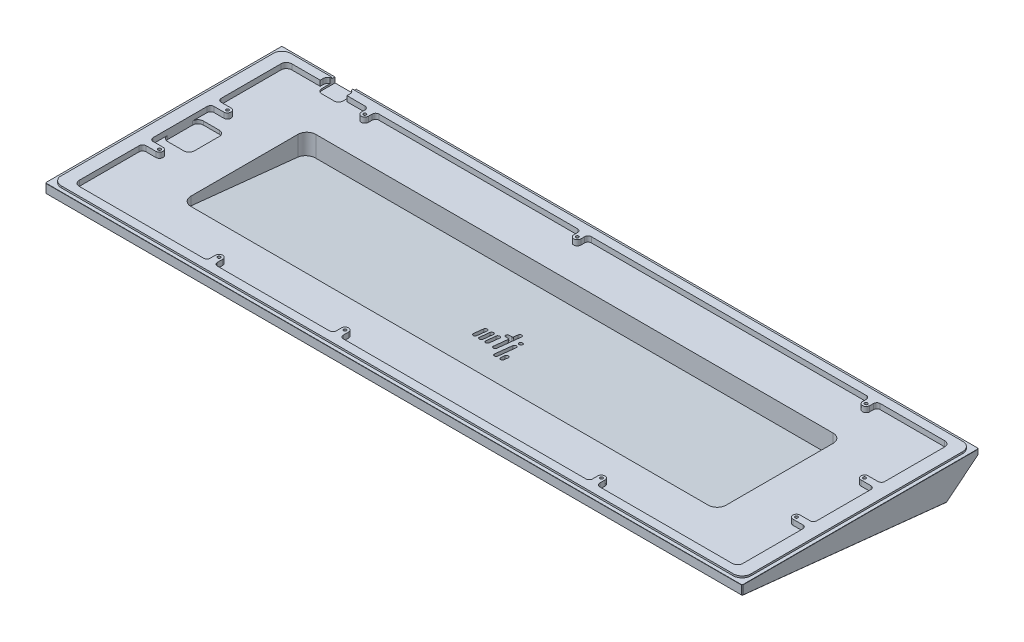
from build123d import *
from OCP.BRepFilletAPI import BRepFilletAPI_MakeChamfer

# Parameters (mm, degrees)
SKETCH1_W                 = 390.7
SKETCH1_H                 = 132.7
MAINBODY_DEPTH            = 18.5
SKETCH2_W                 = 390.7
SKETCH2_H                 = 132.7
SKETCH2_W_2               = 386.6
SKETCH2_H_2               = 128.6
ALIGMENTLIP_DEPTH         = 1
TYPINGANGLE_DEPTH         = 414.035143783
SKETCH4_W                 = 372
SKETCH4_H                 = 119.1
PCBCUTOUT_DEPTH           = 3
SKETCH13_W                = 15
SKETCH13_H                = 20
CUT_EXTRUDE4_DEPTH        = 2
FILLET2_R                 = 3
CHAMFER1_SIZE             = 0.5
CHAMFER1_SIZE_2           = 0.561801899
CHAMFER2_SIZE             = 0.1
SKETCH17_R                = 1
SKETCH17_W                = 2
SKETCH17_H                = 2
CUT_EXTRUDE5_DEPTH        = 10
SKETCH18_W                = 12
SKETCH18_H                = 4
CUT_EXTRUDE6_DEPTH        = 10
SKETCH12_W                = 15
SKETCH12_H                = 3.95
CUT_EXTRUDE3_DEPTH        = 3
FILLET1_R                 = 2.5
SKETCH19_R                = 2
SKETCH19_W                = 4
SKETCH19_H                = 4
SKETCH19_W_2              = 7.45
SKETCH19_H_2              = 4.8
BOSS_EXTRUDE1_DEPTH       = 3
FILLET3_R                 = 1.9
M2X0_4_TAPPED_HOLE1_D     = 1.6
M2X0_4_TAPPED_HOLE1_DEPTH = 4
M2X0_4_TAPPED_HOLE1_TIP   = 0.480688495
CHAMFER3_SIZE             = 0.1
FILLET4_R                 = 5
CUT_EXTRUDE7_REACH        = 414.912
SKETCH23_W                = 300
SKETCH23_H                = 70
FILLET5_R                 = 5
FILLET6_R                 = 0.5


# Some blends are built 0.0001 mm under size
with BuildPart() as part:
    # Sketch1 → MainBody (new body)
    with BuildSketch(Plane(origin=(0, 0, 0), x_dir=(1, 0, 0), z_dir=(0, 1, 0))):
        with Locations((195.35, 66.35)):
            Rectangle(SKETCH1_W, SKETCH1_H)
    extrude(amount=MAINBODY_DEPTH)

    # Sketch2 → AligmentLip (cut)
    with BuildSketch(Plane(origin=(0, 18.5, 0), x_dir=(1, 0, 0), z_dir=(0, 1, 0))):
        with Locations((195.35, 66.35)):
            Rectangle(SKETCH2_W, SKETCH2_H)
        with Locations((195.35, 66.35)):
            Rectangle(SKETCH2_W_2, SKETCH2_H_2, mode=Mode.SUBTRACT)
    extrude(amount=-ALIGMENTLIP_DEPTH, mode=Mode.SUBTRACT)

    # Sketch3 → TypingAngle (cut, through all)
    with BuildSketch(Plane.ZY):
        Polygon((-114.79399123, 0), (-132.7, 14.5), (-132.7, 0), align=None)
        Polygon((0, 12.065334661), (-114.79399123, 0), (0, 0), align=None)
    extrude(amount=-TYPINGANGLE_DEPTH, mode=Mode.SUBTRACT)

    # Sketch4 → PCBCutout (cut)
    with BuildSketch(Plane(origin=(0, 18.5, 0), x_dir=(1, 0, 0), z_dir=(0, 1, 0))):
        with Locations((195.35, 66.35)):
            Rectangle(SKETCH4_W, SKETCH4_H)
    extrude(amount=-PCBCUTOUT_DEPTH, mode=Mode.SUBTRACT)

    # Sketch13 → Cut-Extrude4 (cut)
    with BuildSketch(Plane(origin=(0, 15.5, 0), x_dir=(1, 0, 0), z_dir=(0, 1, 0))):
        with Locations((16.85, 66.35)):
            Rectangle(SKETCH13_W, SKETCH13_H)
    extrude(amount=-CUT_EXTRUDE4_DEPTH, mode=Mode.SUBTRACT)

    # Fillet2
    fillet2_edges = [part.edges().sort_by_distance(p)[0] for p in [
        (9.35, 17, -6.8),
        (9.35, 17, -125.9),
        (381.35, 17, -125.9),
        (381.35, 17, -6.8),
        (9.35, 14.5, -56.35),
        (9.35, 14.5, -76.35),
        (24.35, 14.5, -76.35),
        (24.35, 14.5, -56.35),
    ]]
    fillet(fillet2_edges, radius=FILLET2_R)

    # Chamfer1
    chamfer1_edges_1 = [part.edges().sort_by_distance(p)[0] for p in [
        (0, 16, -132.7),
        (390.7, 16, -132.7),
        (390.7, 14.782667331, 0),
        (0, 14.782667331, 0),
        (0, 7.25, -123.746995615),
        (390.7, 7.25, -123.746995615),
        (0, 6.032667331, -57.396995615),
        (390.7, 6.032667331, -57.396995615),
    ]]
    chamfer1_edges_2 = [part.edges().sort_by_distance(p)[0] for p in [
        (195.35, 12.065334661, 0),
    ]]
    chamfer1_side_2 = [part.faces().sort_by_distance(p)[0] for p in [
        (195.35, 12.064289377, -0.009945219),
    ]]
    chamfer1 = BRepFilletAPI_MakeChamfer(part.part.solid().wrapped)
    for e in chamfer1_edges_1:
        chamfer1.Add(CHAMFER1_SIZE - 0.0001, e.wrapped)
    for e in chamfer1_edges_2:
        chamfer1.Add(CHAMFER1_SIZE_2 - 0.0001, CHAMFER1_SIZE - 0.0001, e.wrapped, chamfer1_side_2[0].wrapped)
    add(Compound.cast(chamfer1.Shape()), mode=Mode.REPLACE)  # a hair under: the kernel refuses the full size

    # Chamfer2
    chamfer2_edges = [part.edges().sort_by_distance(p)[0] for p in [
        (2.05, 18.5, -66.35),
    ]]
    chamfer(chamfer2_edges, length=CHAMFER2_SIZE)

    # Sketch17 → Cut-Extrude5 (cut)
    with BuildSketch(Plane(origin=(0, 11.933506406, -1.254262065), x_dir=(1, 0, 0), z_dir=(0, -0.9945218953682734, 0.10452846326765429))):
        with Locations((205.25, -52.238829109)):
            Circle(SKETCH17_R)
        with BuildLine():
            ThreePointArc((204.25, -52.238829109), (205.25, -51.238829109), (206.25, -52.238829109))
            Line((206.25, -52.238829109), (206.25, -49.738829109))
            ThreePointArc((206.25, -49.738829109), (205.25, -50.738829109), (204.25, -49.738829109))
            Line((204.25, -49.738829109), (204.25, -52.238829109))
        make_face()
        with Locations((205.25, -49.738829109)):
            Circle(SKETCH17_R)
        with Locations((201.75, -49.738829109)):
            Circle(SKETCH17_R)
        with BuildLine():
            ThreePointArc((200.75, -60.238829109), (201.75, -59.238829109), (202.75, -60.238829109))
            Line((202.75, -60.238829109), (202.75, -49.738829109))
            ThreePointArc((202.75, -49.738829109), (201.75, -50.738829109), (200.75, -49.738829109))
            Line((200.75, -49.738829109), (200.75, -60.238829109))
        make_face()
        with Locations((201.75, -60.238829109)):
            Circle(SKETCH17_R)
        with Locations((197.25, -53.738829109)):
            Circle(SKETCH17_R)
        with BuildLine():
            Line((196.25, -62.738829109), (198.25, -62.738829109))
            Line((198.25, -62.738829109), (198.25, -53.738829109))
            ThreePointArc((198.25, -53.738829109), (197.25, -54.738829109), (196.25, -53.738829109))
            Line((196.25, -53.738829109), (196.25, -62.738829109))
        make_face()
        with Locations((197.25, -63.738829109)):
            Rectangle(SKETCH17_W, SKETCH17_H)
        with BuildLine():
            ThreePointArc((196.25, -67.738829109), (197.25, -66.738829109), (198.25, -67.738829109))
            Line((198.25, -67.738829109), (198.25, -64.738829109))
            Line((198.25, -64.738829109), (196.25, -64.738829109))
            Line((196.25, -64.738829109), (196.25, -67.738829109))
        make_face()
        with Locations((197.25, -67.738829109)):
            Circle(SKETCH17_R)
        with BuildLine():
            Line((194.25, -64.738829109), (196.25, -64.738829109))
            Line((196.25, -64.738829109), (196.25, -62.738829109))
            Line((196.25, -62.738829109), (194.25, -62.738829109))
            ThreePointArc((194.25, -62.738829109), (194.957106781, -63.031722328), (195.25, -63.738829109))
            ThreePointArc((195.25, -63.738829109), (194.957106781, -64.44593589), (194.25, -64.738829109))
        make_face()
        with Locations((194.25, -63.738829109)):
            Circle(SKETCH17_R)
        with Locations(Location((201.75, -63.738829109, 0), (0, 0, 270))):
            Circle(SKETCH17_R)
        with Locations((192.45, -60.238829109)):
            Circle(SKETCH17_R)
        with BuildLine():
            ThreePointArc((191.45, -60.238829109), (192.45, -59.238829109), (193.45, -60.238829109))
            Line((193.45, -60.238829109), (193.45, -54.238829109))
            ThreePointArc((193.45, -54.238829109), (192.45, -55.238829109), (191.45, -54.238829109))
            Line((191.45, -54.238829109), (191.45, -60.238829109))
        make_face()
        with Locations((192.45, -54.238829109)):
            Circle(SKETCH17_R)
        with BuildLine():
            ThreePointArc((187.95, -60.238829109), (188.95, -59.238829109), (189.95, -60.238829109))
            Line((189.95, -60.238829109), (189.95, -54.238829109))
            ThreePointArc((189.95, -54.238829109), (188.95, -55.238829109), (187.95, -54.238829109))
            Line((187.95, -54.238829109), (187.95, -60.238829109))
        make_face()
        with Locations((188.95, -60.238829109)):
            Circle(SKETCH17_R)
        with Locations((188.95, -54.238829109)):
            Circle(SKETCH17_R)
        with Locations((185.45, -54.238829109)):
            Circle(SKETCH17_R)
        with BuildLine():
            ThreePointArc((184.45, -60.238829109), (185.45, -59.238829109), (186.45, -60.238829109))
            Line((186.45, -60.238829109), (186.45, -54.238829109))
            ThreePointArc((186.45, -54.238829109), (185.45, -55.238829109), (184.45, -54.238829109))
            Line((184.45, -54.238829109), (184.45, -60.238829109))
        make_face()
        with Locations((185.45, -60.238829109)):
            Circle(SKETCH17_R)
    extrude(amount=-CUT_EXTRUDE5_DEPTH, mode=Mode.SUBTRACT)

    # Sketch18 → Cut-Extrude6 (cut)
    with BuildSketch(Plane(origin=(0, 0, -132.7), x_dir=(-1, 0, 0), z_dir=(0, 0, -1))):
        with Locations((-35.8, 16.5)):
            Rectangle(SKETCH18_W, SKETCH18_H)
    extrude(amount=-CUT_EXTRUDE6_DEPTH, mode=Mode.SUBTRACT)

    # Sketch12 → Cut-Extrude3 (cut)
    with BuildSketch(Plane(origin=(0, 18.5, 0), x_dir=(1, 0, 0), z_dir=(0, 1, 0))):
        with Locations((35.8, 127.875)):
            Rectangle(SKETCH12_W, SKETCH12_H)
    extrude(amount=-CUT_EXTRUDE3_DEPTH, mode=Mode.SUBTRACT)

    # Fillet1
    # the kernel refuses this fillet: 2.5 mm, written as the material it adds along each edge
    with BuildSketch(Plane(origin=(43.3, 18.5, -129.85), x_dir=(-1, 0, 0), z_dir=(0, -1, 0))) as fillet1_piece_1_section:
        with BuildLine():
            CenterArc((2.5, -2.291287847), FILLET1_R, 113.578178478, 66.421821522)
            Line((0, -2.291287847), (0, 0))
            Line((0, 0), (1.5, 0))
        make_face()
    fillet1_piece_1 = extrude(amount=8.728219619, mode=Mode.PRIVATE)
    fillet1_piece_1 = split(fillet1_piece_1, bisect_by=Plane(origin=(42.895833366, 14.5, -128.930757159), z_dir=(0, 1, 0)), keep=Keep.TOP, mode=Mode.PRIVATE)
    add(fillet1_piece_1)
    with BuildSketch(Plane(origin=(28.3, 18.5, -129.85), x_dir=(0, 0, 1), z_dir=(0, -1, 0))) as fillet1_piece_2_section:
        with BuildLine():
            CenterArc((2.291287847, -2.5), FILLET1_R, 90, 66.421821522)
            Line((0, -1.5), (0, 0))
            Line((0, 0), (2.291287847, 0))
        make_face()
    fillet1_piece_2 = extrude(amount=8.728219619, mode=Mode.PRIVATE)
    fillet1_piece_2 = split(fillet1_piece_2, bisect_by=Plane(origin=(28.704166634, 14.5, -128.930757159), z_dir=(0, 1, 0)), keep=Keep.TOP, mode=Mode.PRIVATE)
    add(fillet1_piece_2)
    with BuildSketch(Plane(origin=(41.8, 14.5, -122.7), x_dir=(0, 0, -1), z_dir=(0, 1, 0))) as fillet1_piece_3:
        with BuildLine():
            CenterArc((FILLET1_R, FILLET1_R), FILLET1_R, 180, 90)
            Line((0, FILLET1_R), (0, 0))
            Line((0, 0), (FILLET1_R, 0))
        make_face()
    extrude(amount=1)
    with BuildSketch(Plane(origin=(29.8, 15.5, -122.7), x_dir=(1, 0, 0), z_dir=(0, -1, 0))) as fillet1_piece_4:
        with BuildLine():
            CenterArc((FILLET1_R, -FILLET1_R), FILLET1_R, 90, 90)
            Line((0, -FILLET1_R), (0, 0))
            Line((0, 0), (FILLET1_R, 0))
        make_face()
    extrude(amount=1)

    # Sketch19 → Boss-Extrude1 (add)
    with BuildSketch(Plane(origin=(0, 15.5, 0), x_dir=(1, 0, 0), z_dir=(0, 1, 0))):
        with Locations((57.3, 121.9)):
            Circle(SKETCH19_R)
        with Locations((176.4, 121.9)):
            Circle(SKETCH19_R)
        with Locations((338.3, 121.9)):
            Circle(SKETCH19_R)
        with Locations((16.8, 85.4)):
            Circle(SKETCH19_R)
        with Locations((16.8, 47.3)):
            Circle(SKETCH19_R)
        with Locations((85.9, 11.6)):
            Circle(SKETCH19_R)
        with Locations((156.5, 11.6)):
            Circle(SKETCH19_R)
        with Locations((300.2, 11.6)):
            Circle(SKETCH19_R)
        with Locations((373.9, 85.4)):
            Circle(SKETCH19_R)
        with Locations((373.9, 47.3)):
            Circle(SKETCH19_R)
        with Locations((57.3, 123.9)):
            Rectangle(SKETCH19_W, SKETCH19_H)
        with Locations((176.4, 123.9)):
            Rectangle(SKETCH19_W, SKETCH19_H)
        with Locations((338.3, 123.9)):
            Rectangle(SKETCH19_W, SKETCH19_H)
        with Locations((377.625, 85.4)):
            Rectangle(SKETCH19_W_2, SKETCH19_H)
        with Locations((377.625, 47.3)):
            Rectangle(SKETCH19_W_2, SKETCH19_H)
        with Locations((300.2, 9.2)):
            Rectangle(SKETCH19_W, SKETCH19_H_2)
        with Locations((156.5, 9.2)):
            Rectangle(SKETCH19_W, SKETCH19_H_2)
        with Locations((85.9, 9.2)):
            Rectangle(SKETCH19_W, SKETCH19_H_2)
        with Locations((13.075, 47.3)):
            Rectangle(SKETCH19_W_2, SKETCH19_H)
        with Locations((13.075, 85.4)):
            Rectangle(SKETCH19_W_2, SKETCH19_H)
    extrude(amount=BOSS_EXTRUDE1_DEPTH)

    # Fillet3
    fillet3_edges = [part.edges().sort_by_distance(p)[0] for p in [
        (9.35, 17, -87.4),
        (9.35, 17, -83.4),
        (178.4, 17, -125.9),
        (174.4, 17, -125.9),
        (381.35, 17, -87.4),
        (381.35, 17, -83.4),
        (298.2, 17, -6.8),
        (302.2, 17, -6.8),
        (87.9, 17, -6.8),
        (83.9, 17, -6.8),
        (154.5, 17, -6.8),
        (158.5, 17, -6.8),
        (381.35, 17, -49.3),
        (381.35, 17, -45.3),
        (340.3, 17, -125.9),
        (336.3, 17, -125.9),
        (59.3, 17, -125.9),
        (55.3, 17, -125.9),
        (9.35, 17, -49.3),
        (9.35, 17, -45.3),
    ]]
    fillet(fillet3_edges, radius=FILLET3_R)

    # M2x0.4 Tapped Hole1
    with Locations(Plane(origin=(57.3, 18.5, -121.9), x_dir=(0, 0, 1), z_dir=(0, 1, 0))):
        with Locations((0, 0), (0, 119.1), (74.6, -40.5), (36.5, -40.5), (110.3, 28.6), (110.3, 99.2), (110.3, 242.9), (74.6, 316.6), (36.5, 316.6), (0, 281)):
            Hole(M2X0_4_TAPPED_HOLE1_D / 2, depth=M2X0_4_TAPPED_HOLE1_DEPTH)
            with Locations((0, 0, -(M2X0_4_TAPPED_HOLE1_DEPTH + M2X0_4_TAPPED_HOLE1_TIP / 2))):  # 118° drill point
                Cone(0, M2X0_4_TAPPED_HOLE1_D / 2, M2X0_4_TAPPED_HOLE1_TIP, mode=Mode.SUBTRACT)

    # Chamfer3
    chamfer3_edges = [part.edges().sort_by_distance(p)[0] for p in [
        (195.35, 17.5, 0),
        (216.00005, 17.5, -132.7),
        (390.7, 17.5, -66.35),
        (0, 17.5, -66.35),
        (15.14995, 17.5, -132.7),
    ]]
    chamfer(chamfer3_edges, length=CHAMFER3_SIZE)

    # Fillet4
    fillet4_edges = [part.edges().sort_by_distance(p)[0] for p in [
        (388.65, 18, -2.05),
        (388.65, 18, -130.65),
        (2.05, 17.95, -2.05),
        (2.05, 17.95, -130.65),
    ]]
    fillet(fillet4_edges, radius=FILLET4_R)

    # Cut-Extrude7: up to this plane
    cut_extrude7_end = Plane(origin=(390.7, 14.419811145, -1.515583223), z_dir=(0, -0.9945218953682733, 0.10452846326765426))
    # Sketch23 → Cut-Extrude7 (cut, up to the surface)
    with BuildSketch(Plane(origin=(0, 15.5, 0), x_dir=(1, 0, 0), z_dir=(0, 1, 0)), mode=Mode.PRIVATE) as cut_extrude7_sk1:
        with Locations((195.35, 66.35)):
            Rectangle(SKETCH23_W, SKETCH23_H)
    cut_extrude7_tool1 = split(extrude(cut_extrude7_sk1.sketch, amount=-CUT_EXTRUDE7_REACH, mode=Mode.PRIVATE), bisect_by=cut_extrude7_end, keep=Keep.BOTH, mode=Mode.PRIVATE)
    add(cut_extrude7_tool1.solids().sort_by_distance((195.35, 15.5, -66.35))[0], mode=Mode.SUBTRACT)

    # Fillet5
    fillet5_edges = [part.edges().sort_by_distance(p)[0] for p in [
        (345.35, 13.392043792, -31.35),
        (345.35, 9.713395558, -101.35),
        (45.35, 9.713395558, -101.35),
        (45.35, 13.392043792, -31.35),
    ]]
    fillet(fillet5_edges, radius=FILLET5_R)

    # Fillet6
    fillet6_edges = [part.edges().sort_by_distance(p)[0] for p in [
        (196.25, 6.618665381, -63.780061883),
        (196.25, 6.409608455, -65.769105673),
    ]]
    fillet(fillet6_edges, radius=FILLET6_R)


solid = part.part
